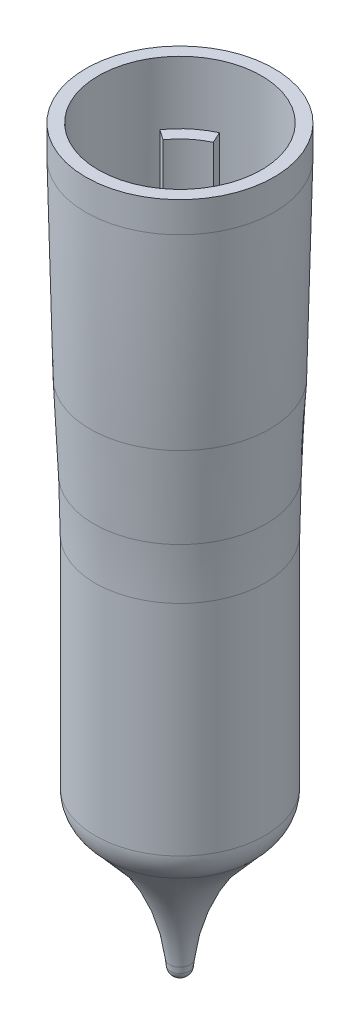
from build123d import *

# Parameters (mm, degrees)
SKETCH1_R           = 4.5
BOSS_EXTRUDE1_DEPTH = 15
FILLET1_R           = 2
SCALE1_SCALE        = 1.5
SKETCH5_R           = 7.5
BOSS_EXTRUDE4_DEPTH = 10
FILLET6_R           = 330
SKETCH6_R           = 6.5
CUT_EXTRUDE1_DEPTH  = 12
BOSS_EXTRUDE5_DEPTH = 7
SKETCH8_R           = 1.75
BOSS_EXTRUDE6_DEPTH = 10
BOSS_EXTRUDE6_TAPER = 6
FILLET8_R           = 0.75
FILLET9_R           = 15


with BuildPart() as part:
    # Sketch1 → Boss-Extrude1 (new body)
    with BuildSketch(Plane(origin=(0, 0, 0), x_dir=(1, 0, 0), z_dir=(0, 1, 0))):
        with Locations(Location((0, 0, 0), (0, 0, 270))):
            Circle(SKETCH1_R)
    extrude(amount=BOSS_EXTRUDE1_DEPTH)

    # Fillet1
    fillet1_edges = [part.edges().sort_by_distance(p)[0] for p in [
        (0, 0, -4.5),
    ]]
    fillet(fillet1_edges, radius=FILLET1_R)


with BuildPart() as part_1:
    # Scale1: scaled about (0, 7.664895453, 0)
    add(part.part.scale(SCALE1_SCALE).moved(Location((0, -3.832447726, 0))))


with BuildPart() as body_2:
    # Sketch5 → Boss-Extrude4 (new body)
    with BuildSketch(Plane(origin=(0, 45, 0), x_dir=(1, 0, 0), z_dir=(0, 1, 0))):
        with Locations(Location((0, 0, 0), (0, 0, 270))):
            Circle(SKETCH5_R)
    extrude(amount=-BOSS_EXTRUDE4_DEPTH)


    add(part_1.part)  # loft1 joins it to this body
    # loft from a face of the part (loft1)
    loft([body_2.faces().sort_by_distance((0, 35, 0))[0], body_2.faces().sort_by_distance((0, 18.667552274, 0))[0]])

    # Fillet6
    # the kernel refuses this fillet: 330 mm, written as the material it takes off along each edge
    with BuildSketch(Plane(origin=(0, 35, 0), x_dir=(0, 0, 1), z_dir=(-1, 0, 0))) as fillet6_piece_1:
        with BuildLine():
            CenterArc((7.5 - FILLET6_R, FILLET6_R * 0.0229483370442), FILLET6_R, 357.370775756, 2.629224244)
            Line((7.5, FILLET6_R * 0.0229483370442), (7.5, 0))
            Line((7.5, 0), (7.5 - FILLET6_R * 0.00105269796789, -FILLET6_R * 0.0229241793765))
        make_face()
    revolve(axis=Axis((0, 35, 0), (0, 1, 0)), mode=Mode.SUBTRACT)

    # Fillet7: read off the stored shape, not the designer's step
    # Fillet7 outline → Fillet7 (revolve)
    with BuildSketch(Plane.XY):
        with BuildLine():
            ThreePointArc((6.75, 16.602201939), (6.773688822, 18.667008654), (6.844742817, 20.730728417))
            Line((6.844742817, 20.730728417), (6.75, 20.730728417))
            Line((6.75, 20.730728417), (6.75, 16.602201939))
        make_face()
    revolve(axis=Axis((0, 0, 0), (0, 1, 0)))

    # Sketch6 → Cut-Extrude1 (cut)
    with BuildSketch(Plane(origin=(0, 45, 0), x_dir=(1, 0, 0), z_dir=(0, 1, 0))):
        with Locations(Location((0, 0, 0), (0, 0, 270))):
            Circle(SKETCH6_R)
    extrude(amount=-CUT_EXTRUDE1_DEPTH, mode=Mode.SUBTRACT)

    # Sketch7 → Boss-Extrude5 (add)
    with BuildSketch(Plane(origin=(0, 33, 0), x_dir=(1, 0, 0), z_dir=(0, 1, 0))):
        with BuildLine():
            Line((-5.324488288, 3.728246836), (-4.505336244, 3.1546704))
            ThreePointArc((-4.505336244, 3.1546704), (-3.535331853, 4.213244437), (-2.32440044, 4.984692829))
            Line((-2.32440044, 4.984692829), (-2.747018701, 5.891000616))
            ThreePointArc((-2.747018701, 5.891000616), (-4.178119463, 4.97928888), (-5.324488288, 3.728246836))
        make_face()
    extrude(amount=BOSS_EXTRUDE5_DEPTH)

    # Sketch8 → Boss-Extrude6 (add)
    with BuildSketch(Plane.XZ.offset(3.832447727)):
        Circle(SKETCH8_R)
    extrude(amount=BOSS_EXTRUDE6_DEPTH, taper=BOSS_EXTRUDE6_TAPER)

    # Fillet8
    fillet8_edges = [body_2.edges().sort_by_distance(p)[0] for p in [
        (-0.698957647, -13.832447727, 0),
    ]]
    fillet(fillet8_edges, radius=FILLET8_R)

    # Fillet9
    # the kernel refuses this fillet: 15 mm, written as the material it adds along each edge
    with BuildSketch(Plane(origin=(0, -3.832447727, 0), x_dir=(1, 0, 0), z_dir=(0, 0, -1))) as fillet9_piece_1:
        with BuildLine():
            CenterArc((15.736552733, 10.428423347), FILLET9_R, 186, 42.247086963)
            Line((5.747758789, -0.761929442), (4.748879394, -1.880964721))
            ThreePointArc((4.748879394, -1.880964721), (3.75, -1.5), (1.75, -1.5))
            Line((1.75, -1.5), (0.258217157, -0.156792695))
            Line((0.258217157, -0.156792695), (0, 2.299979445))
            Line((0, 2.299979445), (0, 8.774445006))
            Line((0, 8.774445006), (0.818724302, 8.860496398))
        make_face()
    revolve(axis=Axis((0, -3.832447727, 0), (0, -1, 0)))


solid = body_2.part
